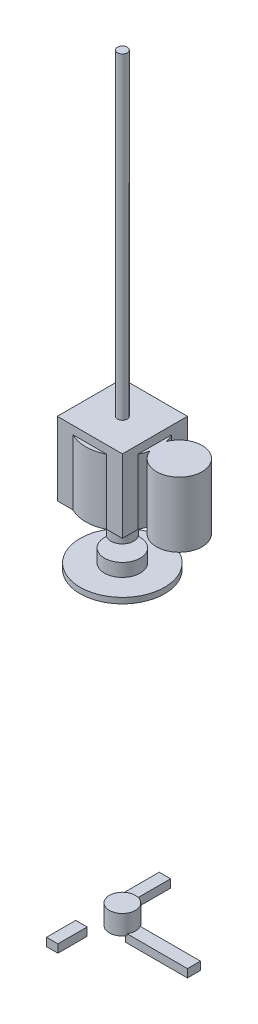
from build123d import *

# Parameters (mm, degrees)
SKETCH1_W           = 400
SKETCH1_H           = 400
BOSS_EXTRUDE1_DEPTH = 450
SKETCH2_R           = 140
BOSS_EXTRUDE2_DEPTH = 400
SKETCH3_R           = 225
BOSS_EXTRUDE3_DEPTH = 400
BOSS_EXTRUDE4_START = -365
SKETCH4_R           = 260
BOSS_EXTRUDE4_DEPTH = 35
BOSS_EXTRUDE5_START = -400
SKETCH5_R           = 110
BOSS_EXTRUDE5_DEPTH = 150
BOSS_EXTRUDE6_START = -180
SKETCH6_R           = 70
BOSS_EXTRUDE6_DEPTH = 180
SKETCH7_R           = 30
BOSS_EXTRUDE7_DEPTH = 2400
BOSS_EXTRUDE8_START = -2260
SKETCH8_R           = 80
BOSS_EXTRUDE8_DEPTH = 120
BOSS_EXTRUDE9_START = -2300
SKETCH9_W           = 380
SKETCH9_H           = 80
SKETCH9_W_2         = 70
SKETCH9_H_2         = 339.807621136
SKETCH9_H_3         = 179.807621136
BOSS_EXTRUDE9_DEPTH = 50


with BuildPart() as part:
    # Sketch1 → Boss-Extrude1 (new body)
    with BuildSketch(Plane(origin=(0, 0, 0), x_dir=(1, 0, 0), z_dir=(0, 1, 0))):
        Rectangle(SKETCH1_W, SKETCH1_H)
    extrude(amount=BOSS_EXTRUDE1_DEPTH)



with BuildPart() as body_2:
    # Sketch2 → Boss-Extrude2 (new body)
    with BuildSketch(Plane(origin=(0, 0, 0), x_dir=(1, 0, 0), z_dir=(0, 1, 0))):
        with Locations((350, 0)):
            Circle(SKETCH2_R)
    extrude(amount=BOSS_EXTRUDE2_DEPTH)


with BuildPart() as part_1:
    add(part.part)

    add(body_2.part)  # Boss-Extrude3 merges body 2
    # Sketch3 → Boss-Extrude3 (add)
    with BuildSketch(Plane(origin=(0, 0, 0), x_dir=(1, 0, 0), z_dir=(0, 1, 0))):
        Circle(SKETCH3_R)
    extrude(amount=BOSS_EXTRUDE3_DEPTH)

    # Sketch6 → Boss-Extrude6 (add)
    with BuildSketch(Plane(origin=(0, 0, 0), x_dir=(1, 0, 0), z_dir=(0, 1, 0)).offset(BOSS_EXTRUDE6_START)):
        Circle(SKETCH6_R)
    extrude(amount=BOSS_EXTRUDE6_DEPTH)

    # Sketch7 → Boss-Extrude7 (add)
    with BuildSketch(Plane(origin=(0, 0, 0), x_dir=(1, 0, 0), z_dir=(0, 1, 0))):
        Circle(SKETCH7_R)
    extrude(amount=BOSS_EXTRUDE7_DEPTH)


with BuildPart() as body_2_2:
    # Sketch4 → Boss-Extrude4 (new body)
    with BuildSketch(Plane(origin=(0, 0, 0), x_dir=(1, 0, 0), z_dir=(0, 1, 0)).offset(BOSS_EXTRUDE4_START)):
        Circle(SKETCH4_R)
    extrude(amount=BOSS_EXTRUDE4_DEPTH)

    # Sketch5 → Boss-Extrude5 (add)
    with BuildSketch(Plane(origin=(0, 0, 0), x_dir=(1, 0, 0), z_dir=(0, 1, 0)).offset(BOSS_EXTRUDE5_START)):
        Circle(SKETCH5_R)
    extrude(amount=BOSS_EXTRUDE5_DEPTH)


with BuildPart() as body_3:
    # Sketch8 → Boss-Extrude8 (new body)
    with BuildSketch(Plane(origin=(0, 0, 0), x_dir=(1, 0, 0), z_dir=(0, 1, 0)).offset(BOSS_EXTRUDE8_START)):
        Circle(SKETCH8_R)
    extrude(amount=BOSS_EXTRUDE8_DEPTH)

    # Sketch9 → Boss-Extrude9 (add)
    with BuildSketch(Plane(origin=(0, 0, 0), x_dir=(1, 0, 0), z_dir=(0, 1, 0)).offset(BOSS_EXTRUDE9_START)):
        with Locations((250, 0)):
            Rectangle(SKETCH9_W, SKETCH9_H)
        with Locations((-125, 216.506350946)):
            Rectangle(SKETCH9_W_2, SKETCH9_H_2)
        with Locations((-125, -216.506350946)):
            Rectangle(SKETCH9_W_2, SKETCH9_H_3)
    extrude(amount=BOSS_EXTRUDE9_DEPTH)


with BuildPart() as boss_extrude9_piece_1:
    # of the separate pieces the step leaves, piece 1, a body of its own (boss_extrude9_pieces)
    add(body_3.part.solids().sort_by_distance((69.282032303, -2250, -40))[0])


with BuildPart() as boss_extrude9_piece_2:
    # of the separate pieces the step leaves, piece 2, a body of its own (boss_extrude9_pieces)
    add(body_3.part.solids().sort_by_distance((-90, -2300, -46.602540378))[0])


with BuildPart() as boss_extrude9_piece_3:
    # of the separate pieces the step leaves, piece 3, a body of its own (boss_extrude9_pieces)
    add(body_3.part.solids().sort_by_distance((-90, -2300, 126.602540378))[0])


solid = Compound([part_1.part, body_2_2.part, boss_extrude9_piece_1.part, boss_extrude9_piece_2.part, boss_extrude9_piece_3.part])
